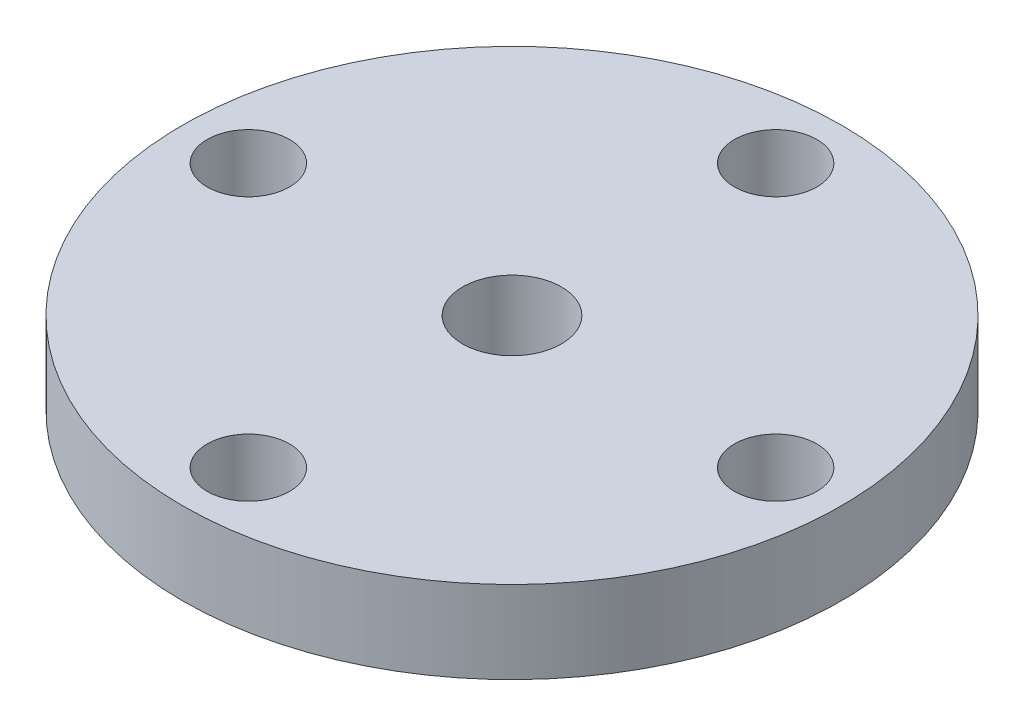
from build123d import *

# Parameters (mm, degrees)
SKETCH1_R           = 10
SKETCH1_R_2         = 1.25
SKETCH1_R_3         = 1.5
BOSS_EXTRUDE1_DEPTH = 2.5


with BuildPart() as part:
    # Sketch1 → Boss-Extrude1 (new body)
    with BuildSketch(Plane(origin=(0, 0, 0), x_dir=(1, 0, 0), z_dir=(0, 1, 0))):
        Circle(SKETCH1_R)
        with Locations((0, -8)):
            Circle(SKETCH1_R_2, mode=Mode.SUBTRACT)
        with Locations((8, 0)):
            Circle(SKETCH1_R_2, mode=Mode.SUBTRACT)
        with Locations((-8, 0)):
            Circle(SKETCH1_R_2, mode=Mode.SUBTRACT)
        Circle(SKETCH1_R_3, mode=Mode.SUBTRACT)
        with Locations((0, 8)):
            Circle(SKETCH1_R_2, mode=Mode.SUBTRACT)
    extrude(amount=BOSS_EXTRUDE1_DEPTH)


solid = part.part
